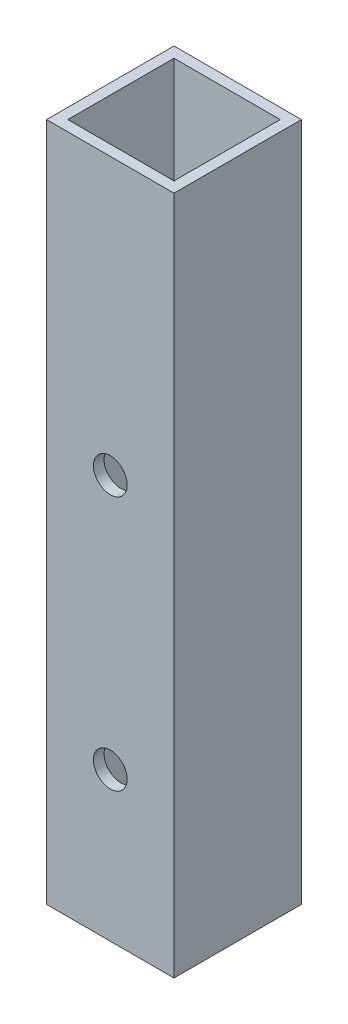
from build123d import *

# Parameters (mm, degrees)
SKETCH1_W                = 38.1
SKETCH1_H                = 38.1
SKETCH1_W_2              = 31.75
SKETCH1_H_2              = 31.75
BOSS_EXTRUDE1_DEPTH      = 203.2
X_0_397_DIAMETER_HOLE1_D = 10.0838


with BuildPart() as part:
    # Sketch1 → Boss-Extrude1 (new body)
    with BuildSketch(Plane(origin=(0, 0, 0), x_dir=(1, 0, 0), z_dir=(0, 1, 0))):
        with Locations((19.05, 19.05)):
            Rectangle(SKETCH1_W, SKETCH1_H)
        with Locations((19.05, 19.05)):
            Rectangle(SKETCH1_W_2, SKETCH1_H_2, mode=Mode.SUBTRACT)
    extrude(amount=BOSS_EXTRUDE1_DEPTH)

    # X (0.397) Diameter Hole1 (through all)
    with Locations(Plane.XY):
        with Locations((19.05, 120.65), (19.05, 44.45)):
            Hole(X_0_397_DIAMETER_HOLE1_D / 2)


solid = part.part
